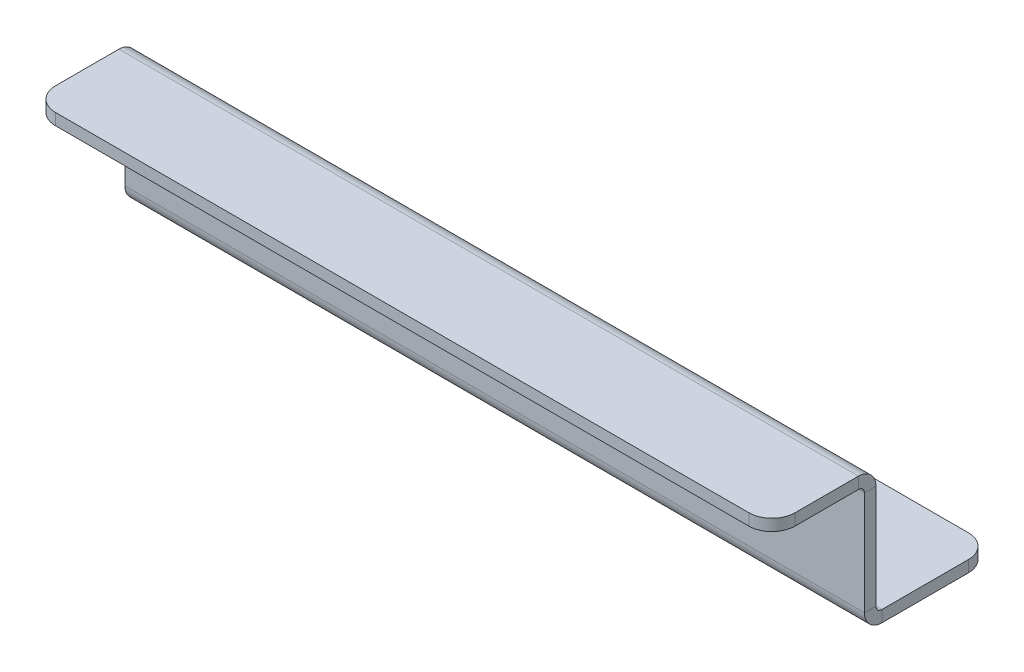
from build123d import *

# Parameters (mm, degrees)
BASE_FLANGE1_DEPTH = 50.8
SKETCH4_R          = 2.7051
CUT_EXTRUDE1_DEPTH = 2.54
FILLET1_R          = 3.175


# Sheet-metal steps are written as plain solids
with BuildPart() as part:
    # Sketch1 → Base-Flange1 (new, symmetric)
    with BuildSketch(Plane(origin=(0, 0, 0), x_dir=(0, 0, -1), z_dir=(1, 0, 0))):
        with BuildLine():
            Line((-12.7, 17.4752), (-0.8128, 17.4752))
            ThreePointArc((-0.8128, 17.4752), (-0.238063608, 17.237136392), (0, 16.6624))
            Line((0, 16.6624), (0, 2.4003))
            ThreePointArc((0, 2.4003), (0.703031593, 0.703031593), (2.4003, 0))
            Line((2.4003, 0), (17.4752, 0))
            Line((17.4752, 0), (17.4752, 1.5875))
            Line((17.4752, 1.5875), (2.4003, 1.5875))
            ThreePointArc((2.4003, 1.5875), (1.825563608, 1.825563608), (1.5875, 2.4003))
            Line((1.5875, 2.4003), (1.5875, 16.6624))
            ThreePointArc((1.5875, 16.6624), (0.884468407, 18.359668407), (-0.8128, 19.0627))
            Line((-0.8128, 19.0627), (-12.7, 19.0627))
            Line((-12.7, 19.0627), (-12.7, 17.4752))
        make_face()
    extrude(amount=BASE_FLANGE1_DEPTH, both=True)

    # Sketch4 → Cut-Extrude1 (cut)
    with BuildSketch(Plane.XZ):
        with Locations(Location((34.93262, -10.3124, 0), (0, 0, 270))):
            Circle(SKETCH4_R)
        with Locations(Location((-34.925, -10.3124, 0), (0, 0, 270))):
            Circle(SKETCH4_R)
    extrude(amount=-CUT_EXTRUDE1_DEPTH, mode=Mode.SUBTRACT)

    # Fillet1
    fillet1_edges = [part.edges().sort_by_distance(p)[0] for p in [
        (-50.8, 0.79375, -17.4752),
        (-50.8, 18.26895, 12.7),
        (50.8, 0.79375, -17.4752),
        (50.8, 18.26895, 12.7),
    ]]
    fillet(fillet1_edges, radius=FILLET1_R)


solid = part.part
